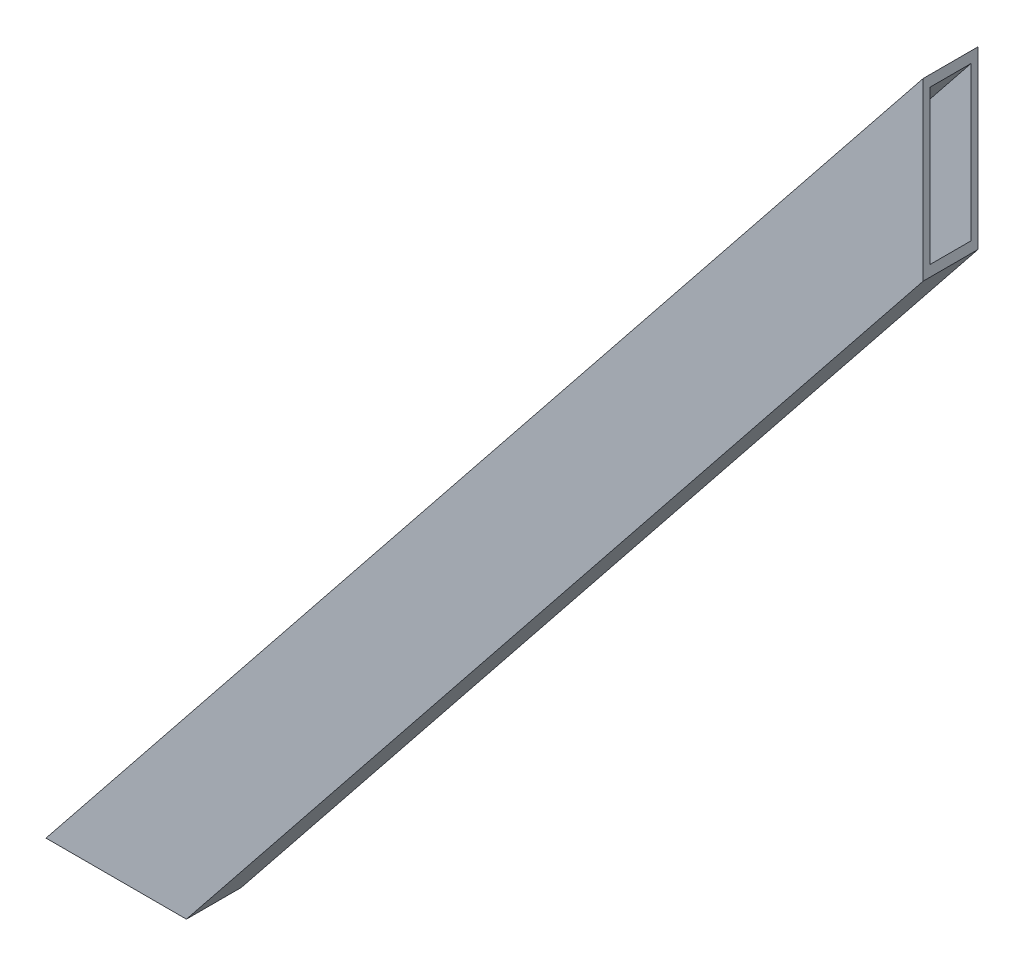
from build123d import *

# Parameters (mm, degrees)
BOSS_EXTRUDE1_DEPTH = 25.4
SHELL1_T            = -3.175


with BuildPart() as part:
    # Sketch1 → Boss-Extrude1 (new body)
    with BuildSketch(Plane.XY):
        Polygon((0, 0), (406.4, 508), (406.4, 426.680322185), (65.055742252, 0), align=None)
    extrude(amount=BOSS_EXTRUDE1_DEPTH)

    # Shell1
    shell1_openings = [part.faces().sort_by_distance(p)[0] for p in [
        (406.4, 467.340161092, 12.7),
        (32.527871126, 0, 12.7),
    ]]
    offset(amount=SHELL1_T, openings=shell1_openings, kind=Kind.INTERSECTION)


solid = part.part
